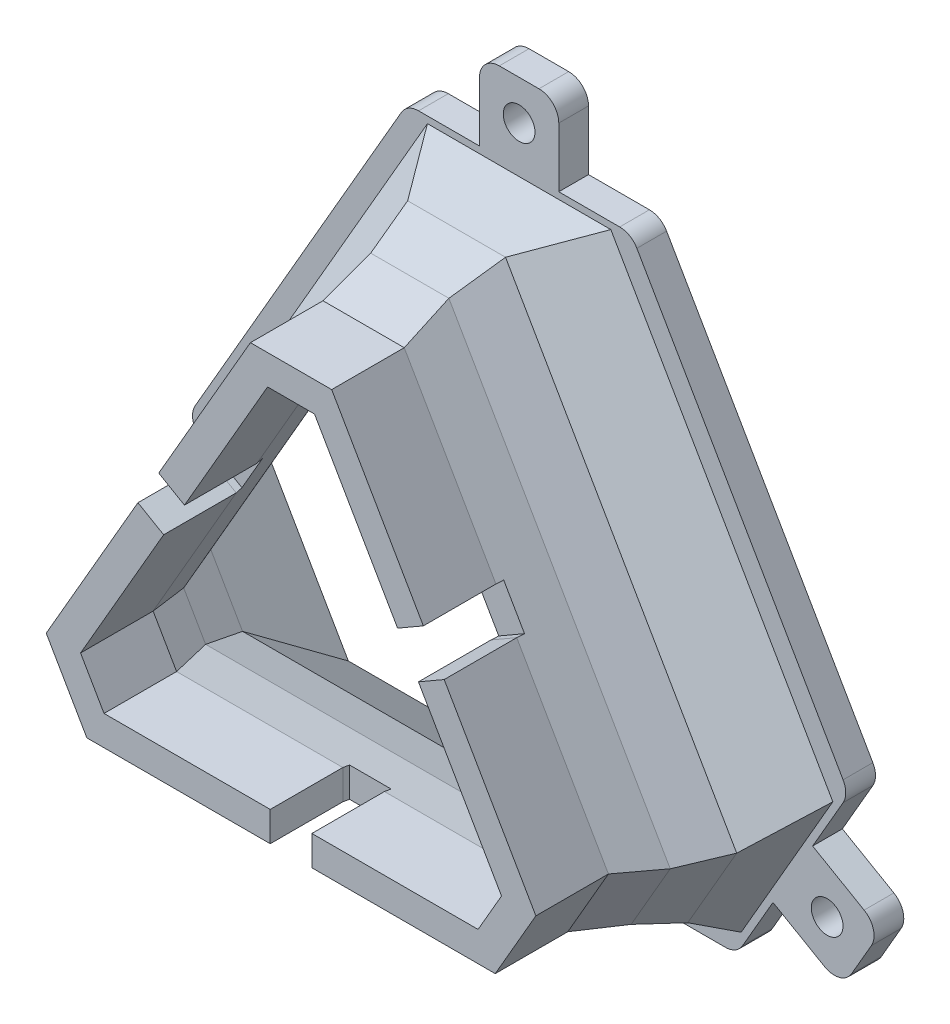
from build123d import *

# Parameters (mm, degrees)
BOSS_EXTRUDE1_DEPTH     = 7.32
BOSS_EXTRUDE6_START     = -3
BOSS_EXTRUDE6_OUTLINE_R = 1.6
BOSS_EXTRUDE6_DEPTH     = 3
FILLET2_R               = 2
SKETCH16_W              = 4.2
SKETCH16_H              = 15
CUT_EXTRUDE1_DEPTH      = 8


# Read off the part's stored shape, not the designer's step: Boss-Extrude6
with BuildPart() as part:
    # Sketch1 → Boss-Extrude1 (new body)
    with BuildSketch(Plane.XY):
        Polygon((-20.599186911, -16.626279442), (20.599186911, -16.626279442), (24.698373822, -9.526279442), (4.099186911, 26.152558883), (-4.099186911, 26.152558883), (-24.698373822, -9.526279442), align=None)
        Polygon((18.867136104, -13.626279442), (21.234272207, -9.526279442), (2.367136104, 23.152558883), (-2.367136104, 23.152558883), (-21.234272207, -9.526279442), (-18.867136104, -13.626279442), align=None, mode=Mode.SUBTRACT)
    extrude(amount=BOSS_EXTRUDE1_DEPTH)


with BuildPart() as body_2:
    # Sketch1<14> → Loft3 section 0
    with BuildSketch(Plane.XY):
        with BuildLine():
            Line((-4.099186911, 26.152558883), (-24.698373822, -9.526279442))
            Line((-24.698373822, -9.526279442), (-20.599186911, -16.626279442))
            Line((-20.599186911, -16.626279442), (20.599186911, -16.626279442))
            Line((20.599186911, -16.626279442), (24.698373822, -9.526279442))
            Line((24.698373822, -9.526279442), (4.099186911, 26.152558883))
            Line((4.099186911, 26.152558883), (-4.099186911, 26.152558883))
        make_face()
    # Sketch5 → Loft3 section 1
    with BuildSketch(Plane.XY.offset(-4.66)):
        with BuildLine():
            Line((-3.943302339, 28.062558883), (-26.274540057, -10.616279442))
            Line((-26.274540057, -10.616279442), (-22.331237719, -17.446279442))
            Line((-22.331237719, -17.446279442), (22.331237719, -17.446279442))
            Line((22.331237719, -17.446279442), (26.274540057, -10.616279442))
            Line((26.274540057, -10.616279442), (3.943302339, 28.062558883))
            Line((3.943302339, 28.062558883), (-3.943302339, 28.062558883))
        make_face()
    loft()

    # Sketch5<46> → Loft4 section 0
    with BuildSketch(Plane.XY.offset(-4.66)):
        with BuildLine():
            Line((-3.943302339, 28.062558883), (-26.274540057, -10.616279442))
            Line((-26.274540057, -10.616279442), (-22.331237719, -17.446279442))
            Line((-22.331237719, -17.446279442), (22.331237719, -17.446279442))
            Line((22.331237719, -17.446279442), (26.274540057, -10.616279442))
            Line((26.274540057, -10.616279442), (3.943302339, 28.062558883))
            Line((3.943302339, 28.062558883), (-3.943302339, 28.062558883))
        make_face()
    # Sketch13 → Loft4 section 1
    with BuildSketch(Plane.XY.offset(-9.38)):
        with BuildLine():
            Line((-4.936344802, 29.782558883), (-28.260624983, -10.616279442))
            Line((-28.260624983, -10.616279442), (-23.324280182, -19.166279442))
            Line((-23.324280182, -19.166279442), (23.324280182, -19.166279442))
            Line((23.324280182, -19.166279442), (28.260624983, -10.616279442))
            Line((28.260624983, -10.616279442), (4.936344802, 29.782558883))
            Line((4.936344802, 29.782558883), (-4.936344802, 29.782558883))
        make_face()
    loft()

    # Sketch13<4> → Loft5 section 0
    with BuildSketch(Plane.XY.offset(-9.38)):
        with BuildLine():
            Line((-4.936344802, 29.782558883), (-28.260624983, -10.616279442))
            Line((-28.260624983, -10.616279442), (-23.324280182, -19.166279442))
            Line((-23.324280182, -19.166279442), (23.324280182, -19.166279442))
            Line((23.324280182, -19.166279442), (28.260624983, -10.616279442))
            Line((28.260624983, -10.616279442), (4.936344802, 29.782558883))
            Line((4.936344802, 29.782558883), (-4.936344802, 29.782558883))
        make_face()
    # Sketch14 → Loft5 section 1
    with BuildSketch(Plane.XY.offset(-18.69)):
        with BuildLine():
            Line((11.3, 31.880384758), (-11.3, 31.880384758))
            Line((-11.3, 31.880384758), (-33.259223083, -6.154105316))
            Line((-33.259223083, -6.154105316), (-21.959223083, -25.726279442))
            Line((-21.959223083, -25.726279442), (21.959223083, -25.726279442))
            Line((21.959223083, -25.726279442), (33.259223083, -6.154105316))
            Line((33.259223083, -6.154105316), (11.3, 31.880384758))
        make_face()
    loft()

    # Sketch1<15> → Cut-Loft1 section 0
    with BuildSketch(Plane.XY):
        with BuildLine():
            Line((-2.367136104, 23.152558883), (2.367136104, 23.152558883))
            Line((2.367136104, 23.152558883), (21.234272207, -9.526279442))
            Line((21.234272207, -9.526279442), (18.867136104, -13.626279442))
            Line((18.867136104, -13.626279442), (-18.867136104, -13.626279442))
            Line((-18.867136104, -13.626279442), (-21.234272207, -9.526279442))
            Line((-21.234272207, -9.526279442), (-2.367136104, 23.152558883))
        make_face()
    # Sketch5<47> → Cut-Loft1 section 1
    with BuildSketch(Plane.XY.offset(-4.66)):
        with BuildLine():
            Line((2.211251531, 25.062558883), (22.810438442, -10.616279442))
            Line((22.810438442, -10.616279442), (20.599186911, -14.446279442))
            Line((20.599186911, -14.446279442), (-20.599186911, -14.446279442))
            Line((-20.599186911, -14.446279442), (-22.810438442, -10.616279442))
            Line((-22.810438442, -10.616279442), (-2.211251531, 25.062558883))
            Line((-2.211251531, 25.062558883), (2.211251531, 25.062558883))
        make_face()
    loft(mode=Mode.SUBTRACT)

    # Sketch14<5> → Cut-Loft2 section 0
    with BuildSketch(Plane.XY.offset(-18.69)):
        with BuildLine():
            Line((29.795121467, -6.154105316), (9.567949192, 28.880384758))
            Line((9.567949192, 28.880384758), (-9.567949192, 28.880384758))
            Line((-9.567949192, 28.880384758), (-29.795121467, -6.154105316))
            Line((-29.795121467, -6.154105316), (-20.227172275, -22.726279442))
            Line((-20.227172275, -22.726279442), (20.227172275, -22.726279442))
            Line((20.227172275, -22.726279442), (29.795121467, -6.154105316))
        make_face()
    # Sketch13<5> → Cut-Loft2 section 1
    with BuildSketch(Plane.XY.offset(-9.38)):
        with BuildLine():
            Line((-24.796523368, -10.616279442), (-21.592229374, -16.166279442))
            Line((-21.592229374, -16.166279442), (21.592229374, -16.166279442))
            Line((21.592229374, -16.166279442), (24.796523368, -10.616279442))
            Line((24.796523368, -10.616279442), (3.204293994, 26.782558883))
            Line((3.204293994, 26.782558883), (-3.204293994, 26.782558883))
            Line((-3.204293994, 26.782558883), (-24.796523368, -10.616279442))
        make_face()
    loft(mode=Mode.SUBTRACT)

    # Sketch13<6> → Cut-Loft3 section 0
    with BuildSketch(Plane.XY.offset(-9.38)):
        with BuildLine():
            Line((-24.796523368, -10.616279442), (-21.592229374, -16.166279442))
            Line((-21.592229374, -16.166279442), (21.592229374, -16.166279442))
            Line((21.592229374, -16.166279442), (24.796523368, -10.616279442))
            Line((24.796523368, -10.616279442), (3.204293994, 26.782558883))
            Line((3.204293994, 26.782558883), (-3.204293994, 26.782558883))
            Line((-3.204293994, 26.782558883), (-24.796523368, -10.616279442))
        make_face()
    # Sketch5<48> → Cut-Loft3 section 1
    with BuildSketch(Plane.XY.offset(-4.66)):
        with BuildLine():
            Line((2.211251531, 25.062558883), (22.810438442, -10.616279442))
            Line((22.810438442, -10.616279442), (20.599186911, -14.446279442))
            Line((20.599186911, -14.446279442), (-20.599186911, -14.446279442))
            Line((-20.599186911, -14.446279442), (-22.810438442, -10.616279442))
            Line((-22.810438442, -10.616279442), (-2.211251531, 25.062558883))
            Line((-2.211251531, 25.062558883), (2.211251531, 25.062558883))
        make_face()
    loft(mode=Mode.SUBTRACT)

    # Boss-Extrude6 outline → Boss-Extrude6 (add)
    with BuildSketch(Plane(origin=(0, 0, -18.69), x_dir=(-1, 0, 0), z_dir=(0, 0, -1)).offset(BOSS_EXTRUDE6_START)):
        Polygon((36.537426313, -16.476090764), (29.609223083, -12.476090764), (33.259223083, -6.154105316), (11.3, 31.880384758), (4, 31.880384758), (4, 39.880384758), (-4, 39.880384758), (-4, 31.880384758), (-11.3, 31.880384758), (-33.259223083, -6.154105316), (-29.609223083, -12.476090764), (-36.537426313, -16.476090764), (-32.537426313, -23.404293994), (-25.609223083, -19.404293994), (-21.959223083, -25.726279442), (21.959223083, -25.726279442), (25.609223083, -19.404293994), (32.537426313, -23.404293994), align=None)
        with Locations((31.073324698, -17.940192379)):
            Circle(BOSS_EXTRUDE6_OUTLINE_R, mode=Mode.SUBTRACT)
        Polygon((-29.795121467, -6.154105316), (-9.567949192, 28.880384758), (9.567949192, 28.880384758), (29.795121467, -6.154105316), (20.227172275, -22.726279442), (-20.227172275, -22.726279442), align=None, mode=Mode.SUBTRACT)
        with Locations((-31.073324698, -17.940192379)):
            Circle(BOSS_EXTRUDE6_OUTLINE_R, mode=Mode.SUBTRACT)
        with Locations((0, 35.880384758)):
            Circle(BOSS_EXTRUDE6_OUTLINE_R, mode=Mode.SUBTRACT)
    extrude(amount=BOSS_EXTRUDE6_DEPTH)

    # Fillet2
    fillet2_edges = [body_2.edges().sort_by_distance(p)[0] for p in [
        (-11.3, 31.880384758, -17.19),
        (-33.259223083, -6.154105316, -17.19),
        (-36.537426313, -16.476090764, -17.19),
        (-32.537426313, -23.404293994, -17.19),
        (-21.959223083, -25.726279442, -17.19),
        (21.959223083, -25.726279442, -17.19),
        (32.537426313, -23.404293994, -17.19),
        (36.537426313, -16.476090764, -17.19),
        (33.259223083, -6.154105316, -17.19),
        (11.3, 31.880384758, -17.19),
        (4, 39.880384758, -17.19),
        (-4, 39.880384758, -17.19),
    ]]
    fillet(fillet2_edges, radius=FILLET2_R)


with BuildPart() as cut_extrude1_tool:
    # Sketch16 → Cut-Extrude1 (new body)
    with BuildSketch(Plane.XY.offset(7.32)):
        with Locations((0, -21.126279442)):
            Rectangle(SKETCH16_W, SKETCH16_H)
        Polygon((-12.850704156, 4.994486373), (-25.841085212, 12.494486373), (-23.741085212, 16.131793069), (-10.750704156, 8.631793069), align=None)
        Polygon((10.750704156, 8.631793069), (23.741085212, 16.131793069), (25.841085212, 12.494486373), (12.850704156, 4.994486373), align=None)
    extrude(amount=-CUT_EXTRUDE1_DEPTH)


with BuildPart() as part_1:
    add(part.part)

    # Cut-Extrude1: cut by cut_extrude1_tool
    add(cut_extrude1_tool.part, mode=Mode.SUBTRACT)


with BuildPart() as body_2_1:
    add(body_2.part)

    # Cut-Extrude1: cut by cut_extrude1_tool
    add(cut_extrude1_tool.part, mode=Mode.SUBTRACT)


solid = Compound([part_1.part, body_2_1.part])
